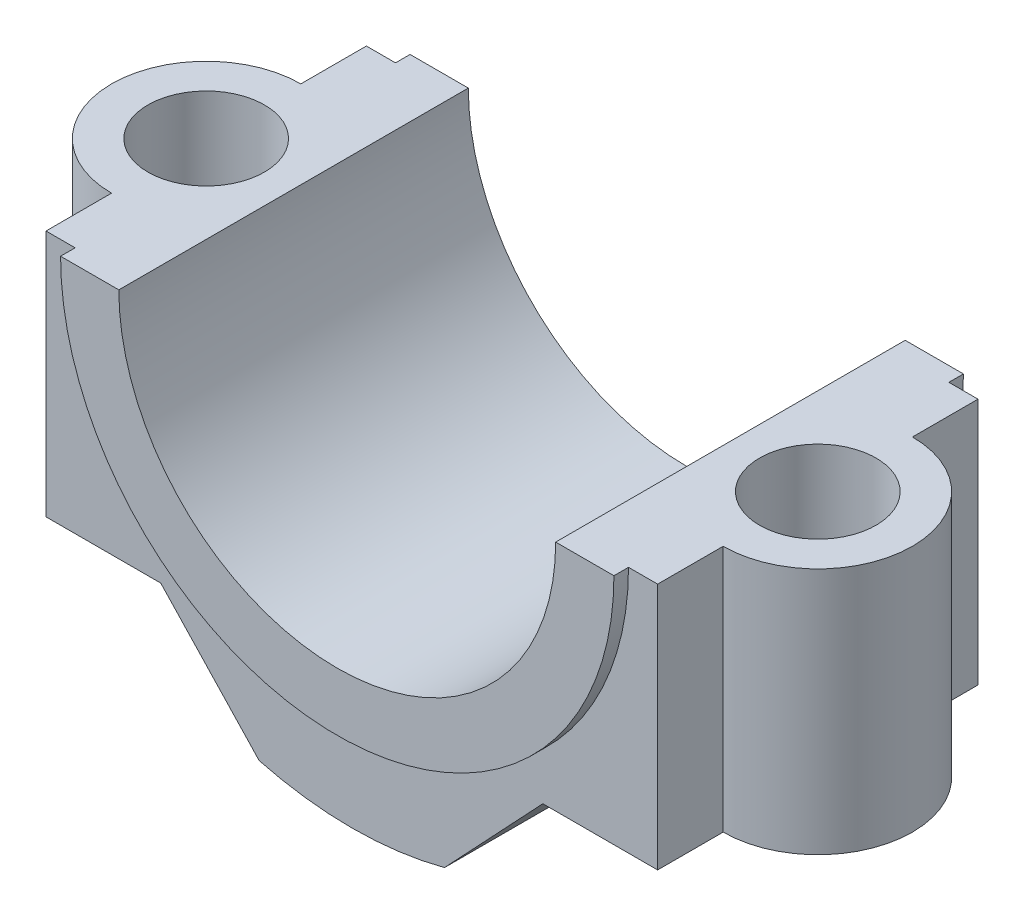
from build123d import *

# Parameters (mm, degrees)
EXTRUDE_2_DEPTH      = 11
EXTRUDE_2_DEPTH_BACK = 11
EXTRUDE_3_DEPTH      = 1
SKETCH_9_R           = 4
CUT_EXTRUDE_5_DEPTH  = 15
CUT_EXTRUDE_6_DEPTH  = 15
CHAMFER_1_SIZE       = 5
CHAMFER_2_SIZE       = 5
SKETCH_11_R          = 4
SKETCH_11_W          = 30
SKETCH_11_H          = 22
EXTRUDE_5_DEPTH      = 2


with BuildPart() as part:
    # Эскиз3 → Бобышка-Вытянуть2 (new, two sides: drawn at the far end of the back side and taken through both)
    with BuildSketch(Plane.XY.offset(-EXTRUDE_2_DEPTH_BACK)):
        with BuildLine():
            ThreePointArc((15, 95), (0, 80), (-15, 95))
            Line((-15, 95), (-27.5, 95))
            Line((-27.5, 95), (-27.5, 80))
            Line((-27.5, 80), (-15, 80))
            Line((-15, 80), (-15, 75))
            ThreePointArc((-15, 75), (0, 70), (15, 75))
            Line((15, 75), (15, 80))
            Line((15, 80), (27.5, 80))
            Line((27.5, 80), (27.5, 95))
            Line((27.5, 95), (15, 95))
        make_face()
    extrude(amount=EXTRUDE_2_DEPTH + EXTRUDE_2_DEPTH_BACK)

    # Эскиз5 → Бобышка-Вытянуть3 (add)
    with BuildSketch(Plane.XY.offset(11)):
        with BuildLine():
            Line((-19, 95), (-15, 95))
            ThreePointArc((-15, 95), (0, 80), (15, 95))
            Line((15, 95), (19, 95))
            ThreePointArc((19, 95), (0, 76), (-19, 95))
        make_face()
    extrude_3 = extrude(amount=EXTRUDE_3_DEPTH)

    # Зеркальное отражение1: Бобышка-Вытянуть3 across plane
    add(extrude_3.mirror(Plane.XY))

    # Эскиз9 → Вырез-Вытянуть5 (cut)
    with BuildSketch(Plane(origin=(0, 95, 0), x_dir=(1, 0, 0), z_dir=(0, 1, 0))):
        with Locations(Location((21, 0, 0), (0, 0, 270))):
            Circle(SKETCH_9_R)
        with Locations(Location((-21, 0, 0), (0, 0, 270))):
            Circle(SKETCH_9_R)
    extrude(amount=-CUT_EXTRUDE_5_DEPTH, mode=Mode.SUBTRACT)

    # Эскиз10 → Вырез-Вытянуть6 (cut)
    with BuildSketch(Plane.XZ.offset(-80)):
        with BuildLine():
            Line((27.5, -11), (27.5, 0))
            ThreePointArc((27.5, 0), (25.596194078, -4.596194078), (21, -6.5))
            Line((21, -6.5), (21, -11))
            Line((21, -11), (27.5, -11))
        make_face()
        with BuildLine():
            Line((21, 11), (21, 6.5))
            ThreePointArc((21, 6.5), (25.596194078, 4.596194078), (27.5, 0))
            Line((27.5, 0), (27.5, 11))
            Line((27.5, 11), (21, 11))
        make_face()
    cut_extrude_6 = extrude(amount=-CUT_EXTRUDE_6_DEPTH, mode=Mode.SUBTRACT)

    # Зеркальное отражение2: Вырез-Вытянуть6 across plane
    add(cut_extrude_6.mirror(Plane(origin=(0, 0, 0), x_dir=(0, 0, 1), z_dir=(1, 0, 0))), mode=Mode.SUBTRACT)

    # Фаска1
    # the kernel refuses this chamfer: 20, 5 mm, written as the material it takes off along each edge
    with BuildSketch(Plane(origin=(-15, 75, -36.862227042), x_dir=(0.9002602258420863, -0.4353521858986766, 0), z_dir=(0, 0, 1))) as chamfer_1_piece_1_section:
        with BuildLine():
            Line((9.593719339, 0), (-CHAMFER_1_SIZE * 0.435352185899, CHAMFER_1_SIZE * 0.900260225842))
            Line((-CHAMFER_1_SIZE * 0.435352185899, CHAMFER_1_SIZE * 0.900260225842), (0, 0))
            ThreePointArc((0, 0), (5.175297631, -0.461648225), (9.593719339, 0))
        make_face()
    chamfer_1_piece_1 = extrude(amount=73.724454084, mode=Mode.PRIVATE)
    chamfer_1_piece_1 = split(chamfer_1_piece_1, bisect_by=Plane(origin=(-15, 80, -36.862227042), z_dir=(0, -1, 0)), keep=Keep.TOP, mode=Mode.PRIVATE)
    add(chamfer_1_piece_1, mode=Mode.SUBTRACT)

    # Фаска2
    # the kernel refuses this chamfer: 20, 5 mm, written as the material it takes off along each edge
    with BuildSketch(Plane(origin=(15, 75, -36.862227042), x_dir=(-0.9002602258420859, -0.43535218589867725, 0), z_dir=(0, 0, 1))) as chamfer_2_piece_1:
        with BuildLine():
            Line((9.593719339, 0), (-CHAMFER_2_SIZE * 0.435352185899, -CHAMFER_2_SIZE * 0.900260225842))
            Line((-CHAMFER_2_SIZE * 0.435352185899, -CHAMFER_2_SIZE * 0.900260225842), (0, 0))
            ThreePointArc((0, 0), (5.175297631, 0.461648225), (9.593719339, 0))
        make_face()
    extrude(amount=73.724454084, mode=Mode.SUBTRACT)

    # Эскиз11 → Бобышка-Вытянуть5 (add)
    # profile 1 of 3: a face of its own
    with BuildSketch(Plane.XZ.offset(-80)):
        with BuildLine():
            Line((-15, 11), (-21, 11))
            Line((-21, 11), (-21, 6.5))
            ThreePointArc((-21, 6.5), (-27.5, 0), (-21, -6.5))
            Line((-21, -6.5), (-21, -11))
            Line((-21, -11), (-15, -11))
            Line((-15, -11), (-15, 11))
        make_face()
        with Locations(Location((-21, 0, 0), (0, 0, 90))):
            Circle(SKETCH_11_R, mode=Mode.SUBTRACT)
    # profile 2 of 3: a face of its own
    with BuildSketch(Plane.XZ.offset(-80)):
        with BuildLine():
            Line((21, -11), (21, -6.5))
            ThreePointArc((21, -6.5), (27.5, 0), (21, 6.5))
            Line((21, 6.5), (21, 11))
            Line((21, 11), (15, 11))
            Line((15, 11), (15, -11))
            Line((15, -11), (21, -11))
        make_face()
        with Locations(Location((21, 0, 0), (0, 0, 90))):
            Circle(SKETCH_11_R, mode=Mode.SUBTRACT)
    # profile 3 of 3: a face of its own
    with BuildSketch(Plane.XZ.offset(-80)):
        Rectangle(SKETCH_11_W, SKETCH_11_H)
    extrude(amount=EXTRUDE_5_DEPTH)


solid = part.part
